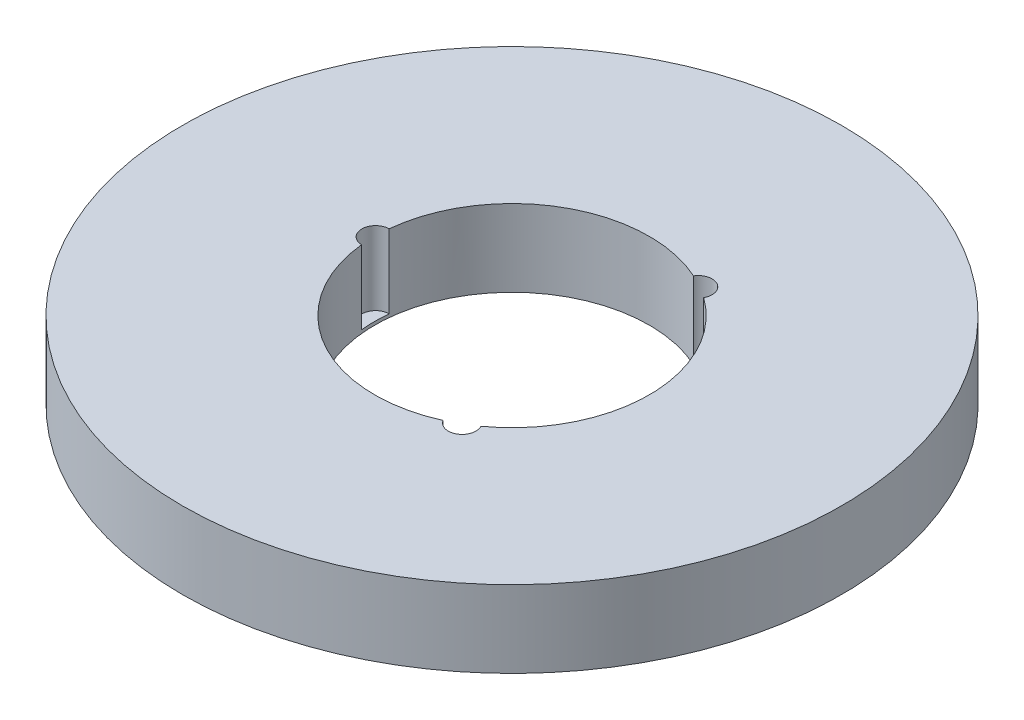
from build123d import *

# Parameters (mm, degrees)
SKETCH1_R           = 60
BOSS_EXTRUDE1_DEPTH = 14
SKETCH2_R           = 25
CUT_EXTRUDE1_DEPTH  = 87
SKETCH3_R           = 2.515550123
CUT_EXTRUDE2_DEPTH  = 13.40732612
CIRPATTERN1_COUNT   = 3


with BuildPart() as part:
    # Sketch1 → Boss-Extrude1 (new body)
    with BuildSketch(Plane(origin=(0, 0, 0), x_dir=(1, 0, 0), z_dir=(0, 1, 0))):
        Circle(SKETCH1_R)
    extrude(amount=BOSS_EXTRUDE1_DEPTH)

    # Sketch2 → Cut-Extrude1 (cut, through all)
    with BuildSketch(Plane(origin=(0, 0, 0), x_dir=(1, 0, 0), z_dir=(0, 1, 0))):
        Circle(SKETCH2_R)
    extrude(amount=CUT_EXTRUDE1_DEPTH, mode=Mode.SUBTRACT)

    # Sketch3 → Cut-Extrude2 (cut)
    with BuildSketch(Plane(origin=(0, 14, 0), x_dir=(1, 0, 0), z_dir=(0, 1, 0))):
        with Locations((-24.823631988, 0)):
            Circle(SKETCH3_R)
    cut_extrude2 = extrude(amount=-CUT_EXTRUDE2_DEPTH, mode=Mode.SUBTRACT)

    # CirPattern1: Cut-Extrude2 ×3 about axis
    cirpattern1_axis = Axis((0, 0, 0), (0, 1, 0))
    for i in range(1, CIRPATTERN1_COUNT):
        add(cut_extrude2.rotate(cirpattern1_axis, i * 360 / CIRPATTERN1_COUNT), mode=Mode.SUBTRACT)


solid = part.part
